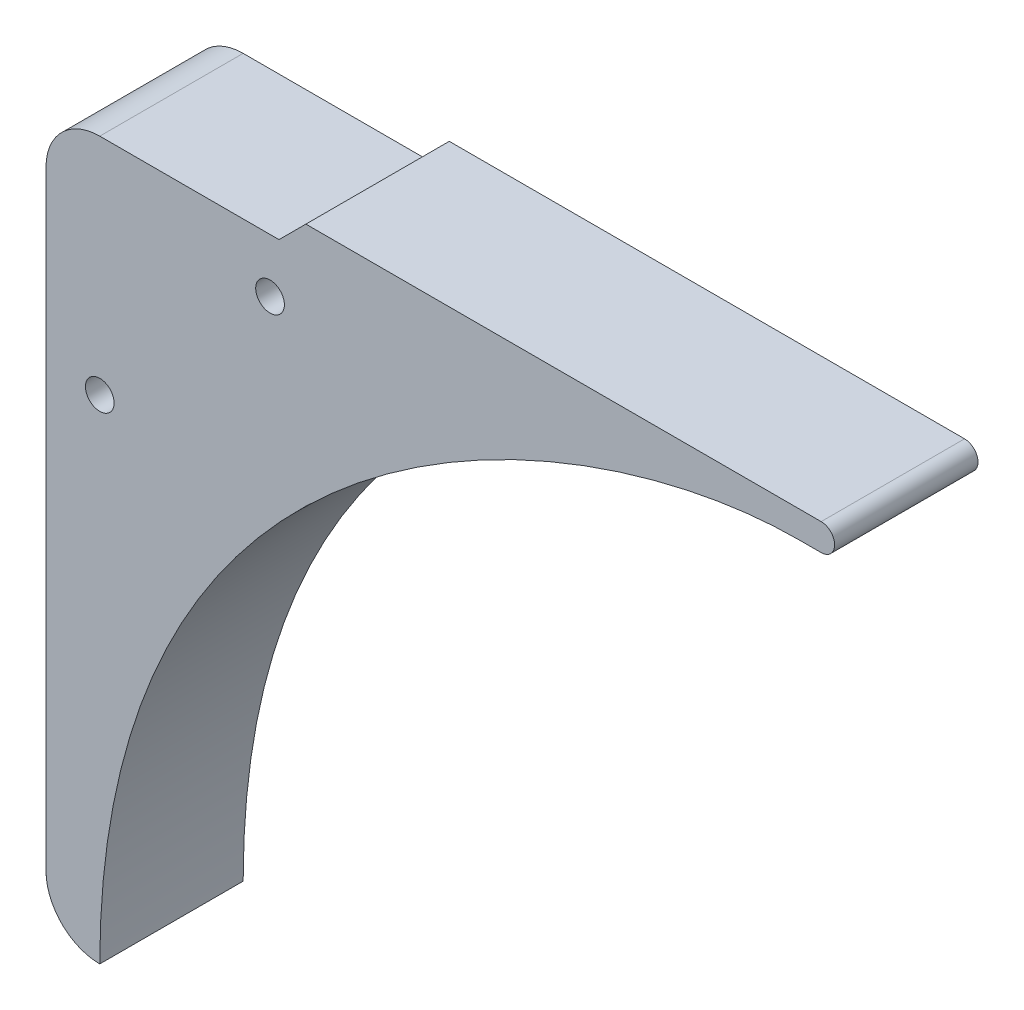
from build123d import *

# Parameters (mm, degrees)
EXTRUDE_641_DEPTH = 8
FILLET_2_R        = 3
FILLET_3_RADIUS   = 0.75
FILLET_3_LENGTH   = 8
HOLE_WIZARD_M2_D  = 1.6
FILLET_4_R        = 3


with BuildPart() as part:
    # Model → Extrude 641 (new body)
    with BuildSketch(Plane.XY):
        with BuildLine():
            Line((0, 0), (13, 0))
            Line((13, 0), (14.5, 1.5))
            Line((14.5, 1.5), (44, 1.5))
            Line((44, 1.5), (44, 0))
            Line((44, 0), (42, 0))
            add(Edge.make_bspline(
                [(3, -40), (3, -11.686704979), (28.988478702, 0), (42, 0)],
                knots=[0, 0, 0, 0, 0.938491694, 0.938491694, 0.938491694, 0.938491694], degree=3))
            Line((3, -40), (0, -40))
            Line((0, -40), (0, 0))
        make_face()
    extrude(amount=-EXTRUDE_641_DEPTH)

    # Скругление2
    fillet_2_edges = [part.edges().sort_by_distance(p)[0] for p in [
        (0, 0, -4),
    ]]
    fillet(fillet_2_edges, radius=FILLET_2_R)

    # Скругление3: full round fillet: the end face becomes a half cylinder, R = half its width
    fillet_3_face = Plane((44, 0.75, -4), x_dir=(0, 0, 1), z_dir=(1, 0, 0))  # on the end face: x along it, z out of the body
    fillet_3_slab = fillet_3_face.offset(-FILLET_3_RADIUS / 2) * Box(FILLET_3_LENGTH, 2 * FILLET_3_RADIUS, FILLET_3_RADIUS, mode=Mode.PRIVATE)  # the body's end, R deep
    fillet_3_round = Plane((43.25, 0.75, -4), x_dir=(1, 0, 0), z_dir=(0, 0, 1)) * Cylinder(FILLET_3_RADIUS, FILLET_3_LENGTH, mode=Mode.PRIVATE)  # its axis R under the face
    add(fillet_3_slab - fillet_3_round, mode=Mode.SUBTRACT)

    # Крепление M2 (through all)
    with Locations(Plane.XY):
        with Locations((3, -12.5), (12.5, -3)):
            Hole(HOLE_WIZARD_M2_D / 2)

    # Скругление4
    fillet_4_edges = [part.edges().sort_by_distance(p)[0] for p in [
        (0, -40, -4),
    ]]
    fillet(fillet_4_edges, radius=FILLET_4_R - 0.0001)  # a hair under: the kernel refuses the full size


solid = part.part
